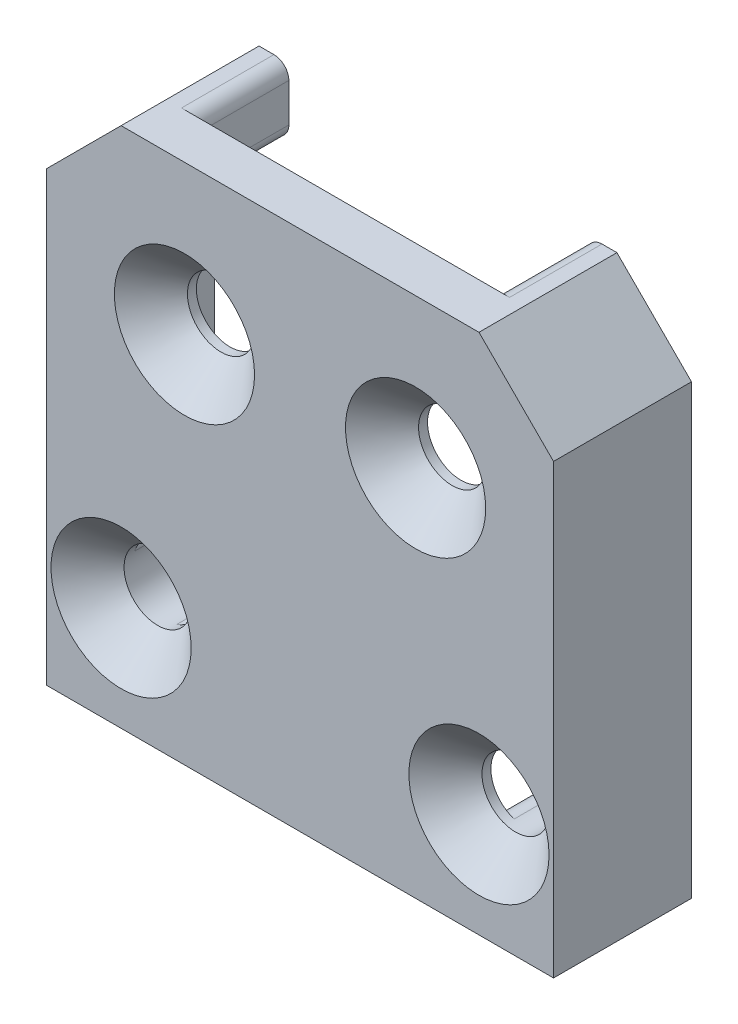
from build123d import *

# Parameters (mm, degrees)
EXTRUDE1_DEPTH                                       = 9.25
CSK_FOR_M4_COUNTERSUNK_RAISED_HEAD_SCREW_D           = 4.5
CSK_FOR_M4_COUNTERSUNK_RAISED_HEAD_SCREW_CSINK_D     = 9.4
CSK_FOR_M4_COUNTERSUNK_RAISED_HEAD_SCREW_CSINK_ANGLE = 90
EXTRUDE2_DEPTH                                       = 6.2
FILLET1_R                                            = 1
FILLET2_R                                            = 1
FILLET3_R                                            = 5


with BuildPart() as part:
    # Sketch1 → Extrude1 (new body)
    with BuildSketch(Plane.XY):
        Polygon((3.357375606748374, 30), (-20.6426243932516, 30), (-25.642624393251616, 25.000000000000007), (-25.642624393251616, -4.999999999999999), (8.357375606748393, -4.999999999999999), (8.357375606748393, 25), align=None)
    extrude(amount=EXTRUDE1_DEPTH)

    # CSK for M4 Countersunk Raised Head Screw1 (through all)
    with Locations(Plane.XY.offset(9.249999999999995)):
        with Locations((-0.892624393, 20), (-16.392624393, 20), (-20.642624393, 2), (3.357375607, 2)):
            CounterSinkHole(CSK_FOR_M4_COUNTERSUNK_RAISED_HEAD_SCREW_D / 2, CSK_FOR_M4_COUNTERSUNK_RAISED_HEAD_SCREW_CSINK_D / 2, counter_sink_angle=CSK_FOR_M4_COUNTERSUNK_RAISED_HEAD_SCREW_CSINK_ANGLE)

    # Sketch6 → Extrude2 (cut)
    with BuildSketch(Plane(origin=(0, 0, 0), x_dir=(-1, 0, 0), z_dir=(0, 0, -1))):
        with BuildLine():
            Line((-1.357375606748385, -4.999999999999999), (-1.357375606748385, 1.9999999999999944))
            ThreePointArc((-1.357375606748385, 1.9999999999999944), (-1.9431620443752904, 3.4142135623730905), (-3.357375606748387, 3.9999999999999947))
            Line((-3.357375606748387, 3.9999999999999947), (-6.357375606748384, 3.9999999999999947))
            Line((-6.357375606748384, 3.9999999999999947), (-6.357375606748382, 20.999999999999996))
            Line((-6.357375606748382, 20.999999999999996), (-1.3573756067483855, 25.999999999999996))
            Line((-1.3573756067483855, 25.999999999999996), (-1.3573756067483855, 30))
            Line((-1.3573756067483855, 30), (18.642624393251616, 30))
            Line((18.642624393251616, 30), (18.642624393251616, 25.999999999999996))
            Line((18.642624393251616, 25.999999999999996), (23.642624393251612, 20.999999999999996))
            Line((23.642624393251612, 20.999999999999996), (23.642624393251612, 3.9999999999999947))
            Line((23.642624393251612, 3.9999999999999947), (20.642624393251616, 3.9999999999999947))
            ThreePointArc((20.642624393251616, 3.9999999999999947), (19.22841083087852, 3.4142135623730896), (18.642624393251616, 1.9999999999999944))
            Line((18.642624393251616, 1.9999999999999944), (18.642624393251616, -4.999999999999999))
            Line((18.642624393251616, -4.999999999999999), (-1.357375606748385, -4.999999999999999))
        make_face()
    extrude(amount=-EXTRUDE2_DEPTH, mode=Mode.SUBTRACT)

    # Fillet1
    # the kernel refuses this fillet: 1 mm, written as the material it takes off along each edge
    with BuildSketch(Plane(origin=(1.3573756067483842, -4.999999999999999, -2.5000000000000004), x_dir=(1, 0, 0), z_dir=(0, 0, 1))) as fillet1_piece_1:
        with BuildLine():
            CenterArc((FILLET1_R, FILLET1_R), FILLET1_R, 180, 90)
            Line((0, FILLET1_R), (0, 0))
            Line((0, 0), (FILLET1_R, 0))
        make_face()
    extrude(amount=8.700000000000001, mode=Mode.SUBTRACT)
    with BuildSketch(Plane(origin=(-18.642624393251616, -4.999999999999999, -2.5000000000000004), x_dir=(-1, 0, 0), z_dir=(0, 0, 1))) as fillet1_piece_2:
        with BuildLine():
            CenterArc((FILLET1_R, -FILLET1_R), FILLET1_R, 90, 90)
            Line((0, -FILLET1_R), (0, 0))
            Line((0, 0), (FILLET1_R, 0))
        make_face()
    extrude(amount=8.700000000000001, mode=Mode.SUBTRACT)
    with BuildSketch(Plane(origin=(-18.642624393251616, 30, -2.5000000000000004), x_dir=(-1, 0, 0), z_dir=(0, 0, 1))) as fillet1_piece_3:
        with BuildLine():
            CenterArc((FILLET1_R, FILLET1_R), FILLET1_R, 180, 90)
            Line((0, FILLET1_R), (0, 0))
            Line((0, 0), (FILLET1_R, 0))
        make_face()
    extrude(amount=8.700000000000001, mode=Mode.SUBTRACT)
    with BuildSketch(Plane(origin=(1.3573756067483855, 30, -2.5000000000000004), x_dir=(1, 0, 0), z_dir=(0, 0, 1))) as fillet1_piece_4:
        with BuildLine():
            CenterArc((FILLET1_R, -FILLET1_R), FILLET1_R, 90, 90)
            Line((0, -FILLET1_R), (0, 0))
            Line((0, 0), (FILLET1_R, 0))
        make_face()
    extrude(amount=8.700000000000001, mode=Mode.SUBTRACT)
    with BuildSketch(Plane(origin=(1.3573756067483855, 25.999999999999996, -1.0355339059327398), x_dir=(0, 1, 0), z_dir=(0, 0, 1))) as fillet1_piece_5:
        with BuildLine():
            CenterArc((FILLET1_R * 0.414213562373, -FILLET1_R), FILLET1_R, 90, 44.999999999999886)
            Line((-FILLET1_R * 0.292893218813, -FILLET1_R * 0.292893218813), (0, 0))
            Line((0, 0), (FILLET1_R * 0.414213562373, 0))
        make_face()
    extrude(amount=7.23553390593274, mode=Mode.SUBTRACT)
    with BuildSketch(Plane(origin=(-18.642624393251616, 25.999999999999996, -1.0355339059327398), x_dir=(0, 1, 0), z_dir=(0, 0, 1))) as fillet1_piece_6:
        with BuildLine():
            CenterArc((FILLET1_R * 0.414213562373, FILLET1_R), FILLET1_R, 225.0000000000001, 44.999999999999886)
            Line((-FILLET1_R * 0.292893218813, FILLET1_R * 0.292893218813), (0, 0))
            Line((0, 0), (FILLET1_R * 0.414213562373, 0))
        make_face()
    extrude(amount=7.23553390593274, mode=Mode.SUBTRACT)
    with BuildSketch(Plane(origin=(4.388152013404426, 3.9999999999999947, 6.2), x_dir=(0.6476614705960325, -0.7619282246415239, 0), z_dir=(0, 0, -1))) as fillet1_piece_7:
        with BuildLine():
            CenterArc((2.093085588135569, -0.924755812678291), FILLET1_R, 112.36843760662408, 102.77681294898315)
            Line((1.275390248397613, -1.5004070363987214), (0, 0))
            ThreePointArc((0, 0), (0.8562622860554598, -0.1692994214738442), (1.71252457211092, -2e-17))
        make_face()
    extrude(amount=11.123058983359915, mode=Mode.SUBTRACT)
    with BuildSketch(Plane(origin=(1.357375606748385, 0.9692235940837892, 6.2), x_dir=(0, -1, 0), z_dir=(0, 0, -1))) as fillet1_piece_8:
        with BuildLine():
            CenterArc((2.0615528132156675, -1), FILLET1_R, 90, 107.92021314405432)
            ThreePointArc((1.110066899636628, -1.3076923077697278), (0.6845392185374297, -0.5439119848812466), (0, 0))
            Line((0, 0), (2.0615528132156675, 0))
        make_face()
    extrude(amount=11.35388203303917, mode=Mode.SUBTRACT)
    with BuildSketch(Plane(origin=(-18.642624393251616, 0.9692235931073754, 6.2), x_dir=(0, -1, 0), z_dir=(0, 0, -1))) as fillet1_piece_9:
        with BuildLine():
            CenterArc((2.061552812401989, 1), FILLET1_R, 162.07978686526982, 107.92021313473018)
            ThreePointArc((1.1100668987728768, 1.3076923076148859), (0.6845392180349299, 0.543911984936301), (0, 0))
            Line((0, 0), (2.061552812401989, 0))
        make_face()
    extrude(amount=11.353882031004975, mode=Mode.SUBTRACT)
    with BuildSketch(Plane(origin=(-21.673400799404423, 3.9999999999999947, 6.2), x_dir=(-0.6476614705905301, -0.7619282246462011, 0), z_dir=(0, 0, -1))) as fillet1_piece_10:
        with BuildLine():
            CenterArc((2.0930855881723076, 0.9247558126755415), FILLET1_R, 144.8547494166881, 102.77681297627396)
            Line((1.2753902487127007, 1.5004070367913585), (0, 0))
            ThreePointArc((0, 0), (0.8562622860704877, 0.16929942148002802), (1.7125245721409794, -5e-17))
        make_face()
    extrude(amount=11.123058984617991, mode=Mode.SUBTRACT)

    # Fillet2
    fillet2_edges = [part.edges().sort_by_distance(p)[0] for p in [
        (-23.642624393251612, 3.9999999999999947, 3.1),
        (6.357375606748384, 3.9999999999999947, 3.1),
    ]]
    fillet(fillet2_edges, radius=FILLET2_R)

    # Fillet3
    fillet3_edges = [part.edges().sort_by_distance(p)[0] for p in [
        (6.357375606748382, 20.999999999999996, 3.1),
        (-23.642624393251612, 20.999999999999996, 3.1),
    ]]
    fillet(fillet3_edges, radius=FILLET3_R)


solid = part.part
